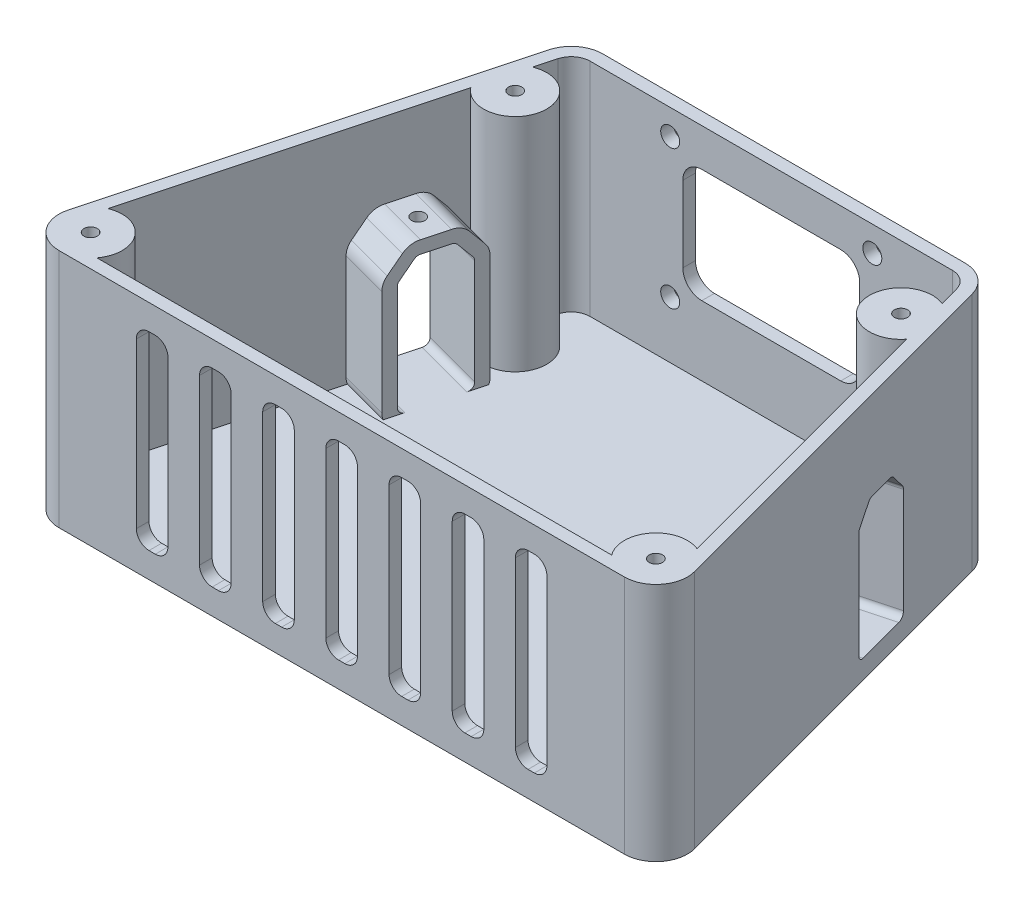
from build123d import *

# Parameters (mm, degrees)
BOSS_EXTRUDE1_DEPTH     = 38
FILLET1_R               = 5
CUT_EXTRUDE3_DEPTH      = 35
SKETCH6_R               = 5
BOSS_EXTRUDE2_DEPTH     = 35
SKETCH7_R               = 1.05
CUT_EXTRUDE5_DEPTH      = 8
CUT_EXTRUDE7_DEPTH      = 6
SKETCH12_W              = 28
SKETCH12_H              = 18
CUT_EXTRUDE8_DEPTH      = 3
FILLET7_R               = 3
FILLET6_R               = 1
FILLET8_R               = 3
SKETCH13_R              = 1.5
CUT_EXTRUDE9_DEPTH      = 10
BOSS_EXTRUDE3_START     = -10
BOSS_EXTRUDE3_DEPTH     = 10
SKETCH26_R              = 1.05
CUT_EXTRUDE17_DEPTH     = 15
CUT_EXTRUDE14_DEPTH     = 10
LPATTERN1_COUNT         = 4
LPATTERN1_PITCH         = 10
LPATTERN2_COPY_1_DEPTH  = 10
LPATTERN2_COPY_2_DEPTH  = 10
LPATTERN2_COPY_3_DEPTH  = 10
LPATTERN2_COPY_4_DEPTH  = 10
LPATTERN2_COPY_5_DEPTH  = 10
LPATTERN2_COPY_6_DEPTH  = 10
LPATTERN2_COPY_7_DEPTH  = 10
LPATTERN2_COPY_8_DEPTH  = 10
LPATTERN2_COPY_9_DEPTH  = 10
LPATTERN2_COPY_10_DEPTH = 10
LPATTERN2_COPY_11_DEPTH = 10
LPATTERN2_COPY_12_DEPTH = 10


# Read off the part's stored shape, not the designer's step: Mirror1
with BuildPart() as part:
    # Sketch1 → Boss-Extrude1 (new body)
    with BuildSketch(Plane(origin=(0, 0, 0), x_dir=(1, 0, 0), z_dir=(0, 1, 0))):
        Polygon((-51.25644347, 0), (51.25644347, 0), (32.5, 70), (-32.5, 70), align=None)
    extrude(amount=BOSS_EXTRUDE1_DEPTH)

    # Fillet1
    fillet1_edges = [part.edges().sort_by_distance(p)[0] for p in [
        (-32.5, 19, -70),
        (32.5, 19, -70),
        (51.25644347, 19, 0),
        (-51.25644347, 19, 0),
    ]]
    fillet(fillet1_edges, radius=FILLET1_R)

    # Sketch4 → Cut-Extrude3 (cut)
    with BuildSketch(Plane(origin=(0, 38, 0), x_dir=(1, 0, 0), z_dir=(0, 1, 0))):
        with BuildLine():
            Line((28.66336506, 68), (-28.66336506, 68))
            ThreePointArc((-28.66336506, 68), (-30.489649347, 67.380060021), (-31.561142539, 65.776457135))
            Line((-31.561142539, 65.776457135), (-47.638094085, 5.776457135))
            ThreePointArc((-47.638094085, 5.776457135), (-47.120376627, 3.173715713), (-44.740316606, 2))
            Line((-44.740316606, 2), (44.740316606, 2))
            ThreePointArc((44.740316606, 2), (47.120376627, 3.173715713), (47.638094085, 5.776457135))
            Line((47.638094085, 5.776457135), (31.561142539, 65.776457135))
            ThreePointArc((31.561142539, 65.776457135), (30.489649347, 67.380060021), (28.66336506, 68))
        make_face()
    extrude(amount=-CUT_EXTRUDE3_DEPTH, mode=Mode.SUBTRACT)

    # Sketch6 → Boss-Extrude2 (add)
    with BuildSketch(Plane(origin=(0, 38, 0), x_dir=(1, 0, 0), z_dir=(0, 1, 0))):
        with Locations((-30.539009407, 58)):
            Circle(SKETCH6_R)
        with Locations((-44.740316606, 5)):
            Circle(SKETCH6_R)
        with Locations((44.740316606, 5)):
            Circle(SKETCH6_R)
        with Locations((30.539009407, 58)):
            Circle(SKETCH6_R)
    extrude(amount=-BOSS_EXTRUDE2_DEPTH)

    # Sketch7 → Cut-Extrude5 (cut)
    with BuildSketch(Plane(origin=(0, 38, 0), x_dir=(1, 0, 0), z_dir=(0, 1, 0))):
        with Locations(Location((-30.539009407, 58, 0), (0, 0, 270))):
            Circle(SKETCH7_R)
        with Locations(Location((-44.740316606, 5, 0), (0, 0, 270))):
            Circle(SKETCH7_R)
        with Locations(Location((44.740316606, 5, 0), (0, 0, 270))):
            Circle(SKETCH7_R)
        with Locations(Location((30.539009407, 58, 0), (0, 0, 270))):
            Circle(SKETCH7_R)
    extrude(amount=-CUT_EXTRUDE5_DEPTH, mode=Mode.SUBTRACT)

    # Sketch10 → Cut-Extrude7 (cut)
    with BuildSketch(Plane(origin=(47.822912811, 0, -12.814110868), x_dir=(-0.258819045102518, 0, -0.9659258262890691), z_dir=(0.9659258262890691, 0, -0.258819045102518))):
        Polygon((30, 3), (40, 3), (40, 21), (37.5, 24), (32.5, 24), (30, 21), align=None)
    extrude(amount=-CUT_EXTRUDE7_DEPTH, mode=Mode.SUBTRACT)

    # Sketch12 → Cut-Extrude8 (cut)
    with BuildSketch(Plane(origin=(0, 0, -70), x_dir=(-1, 0, 0), z_dir=(0, 0, -1))):
        with Locations((0, 23)):
            Rectangle(SKETCH12_W, SKETCH12_H)
    extrude(amount=-CUT_EXTRUDE8_DEPTH, mode=Mode.SUBTRACT)

    # Fillet7
    fillet7_edges = [part.edges().sort_by_distance(p)[0] for p in [
        (14, 14, -69),
    ]]
    fillet(fillet7_edges, radius=FILLET7_R)

    # Fillet6
    fillet6_edges = [part.edges().sort_by_distance(p)[0] for p in [
        (39.092415632, 21, -41.533066611),
        (38.445368019, 24, -43.947881177),
        (37.151272794, 24, -48.777510308),
        (36.504225181, 3, -51.192324874),
        (39.092415632, 3, -41.533066611),
        (36.504225181, 21, -51.192324874),
    ]]
    fillet(fillet6_edges, radius=FILLET6_R)

    # Fillet8
    fillet8_edges = [part.edges().sort_by_distance(p)[0] for p in [
        (14, 32, -69),
        (-14, 32, -69),
        (-14, 14, -69),
    ]]
    fillet(fillet8_edges, radius=FILLET8_R)

    # Sketch13 → Cut-Extrude9 (cut)
    with BuildSketch(Plane(origin=(0, 0, -70), x_dir=(-1, 0, 0), z_dir=(0, 0, -1))):
        with Locations((16, 34)):
            Circle(SKETCH13_R)
        with Locations((-16, 34)):
            Circle(SKETCH13_R)
        with Locations((-16, 12)):
            Circle(SKETCH13_R)
        with Locations((16, 12)):
            Circle(SKETCH13_R)
    extrude(amount=-CUT_EXTRUDE9_DEPTH, mode=Mode.SUBTRACT)

    # Sketch25 → Boss-Extrude3 (add)
    with BuildSketch(Plane(origin=(47.822912811, 0, -12.814110868), x_dir=(-0.25881904510251796, 0, -0.9659258262890691), z_dir=(0.9659258262890691, 0, -0.25881904510251796)).offset(BOSS_EXTRUDE3_START)):
        with BuildLine():
            Line((31, 1), (39, 1))
            ThreePointArc((39, 1), (41.121320344, 1.878679656), (42, 4))
            Line((42, 4), (42, 20.637950065))
            ThreePointArc((42, 20.637950065), (41.820814733, 21.659225856), (41.304663839, 22.558503264))
            Line((41.304663839, 22.558503264), (39.336288893, 24.920553199))
            ThreePointArc((39.336288893, 24.920553199), (38.304091243, 25.716768264), (37.031625054, 26))
            Line((37.031625054, 26), (32.968374946, 26))
            ThreePointArc((32.968374946, 26), (31.695908757, 25.716768264), (30.663711107, 24.920553199))
            Line((30.663711107, 24.920553199), (28.695336161, 22.558503264))
            ThreePointArc((28.695336161, 22.558503264), (28.179185267, 21.659225856), (28, 20.637950065))
            Line((28, 20.637950065), (28, 4))
            ThreePointArc((28, 4), (28.878679656, 1.878679656), (31, 1))
        make_face()
        with BuildLine():
            Line((40, 4), (40, 20.637950065))
            ThreePointArc((40, 20.637950065), (39.940271578, 20.978375329), (39.76822128, 21.278134464))
            Line((39.76822128, 21.278134464), (37.799846334, 23.6401844))
            ThreePointArc((37.799846334, 23.6401844), (37.45578045, 23.905589421), (37.031625054, 24))
            Line((37.031625054, 24), (32.968374946, 24))
            ThreePointArc((32.968374946, 24), (32.54421955, 23.905589421), (32.200153666, 23.6401844))
            Line((32.200153666, 23.6401844), (30.23177872, 21.278134464))
            ThreePointArc((30.23177872, 21.278134464), (30.059728422, 20.978375329), (30, 20.637950065))
            Line((30, 20.637950065), (30, 4))
            ThreePointArc((30, 4), (30.292893219, 3.292893219), (31, 3))
            Line((31, 3), (39, 3))
            ThreePointArc((39, 3), (39.707106781, 3.292893219), (40, 4))
        make_face(mode=Mode.SUBTRACT)
    extrude(amount=BOSS_EXTRUDE3_DEPTH)

    # Sketch26 → Cut-Extrude17 (cut)
    with BuildSketch(Plane(origin=(0, 26, 0), x_dir=(1, 0, 0), z_dir=(0, 1, 0))):
        with Locations(Location((32.948421739, 45.063169311, 0), (0, 0, 270))):
            Circle(SKETCH26_R)
    extrude(amount=-CUT_EXTRUDE17_DEPTH, mode=Mode.SUBTRACT)

    # Mirror1
    split(bisect_by=Plane(origin=(0, 0, 0), x_dir=(0, 0, 1), z_dir=(1, 0, 0)), keep=Keep.TOP)

    # Mirror1 2: part across plane


with BuildPart() as part_1:
    add(part.part)
    add(part.part.mirror(Plane(origin=(0, 0, 0), x_dir=(0, 0, 1), z_dir=(1, 0, 0))))

    # Sketch22 → Cut-Extrude14 (cut)
    with BuildSketch(Plane.XY):
        with BuildLine():
            Line((-0.5, 4), (0.5, 4))
            ThreePointArc((0.5, 4), (1.914213562, 4.585786438), (2.5, 6))
            Line((2.5, 6), (2.5, 32))
            ThreePointArc((2.5, 32), (1.914213562, 33.414213562), (0.5, 34))
            Line((0.5, 34), (-0.5, 34))
            ThreePointArc((-0.5, 34), (-1.914213562, 33.414213562), (-2.5, 32))
            Line((-2.5, 32), (-2.5, 6))
            ThreePointArc((-2.5, 6), (-1.914213562, 4.585786438), (-0.5, 4))
        make_face()
    cut_extrude14 = extrude(amount=-CUT_EXTRUDE14_DEPTH, mode=Mode.SUBTRACT)

    # LPattern1: Cut-Extrude14 ×4
    with Locations(*[(i * LPATTERN1_PITCH, 0, 0) for i in range(1, LPATTERN1_COUNT)]):
        add(cut_extrude14, mode=Mode.SUBTRACT)

    # LPattern2 copy 1 sketch → LPattern2 copy 1 (cut)
    with BuildSketch(Plane.XY):
        with BuildLine():
            Line((-0.5, 4), (0.5, 4))
            ThreePointArc((0.5, 4), (1.914213562, 4.585786438), (2.5, 6))
            Line((2.5, 6), (2.5, 32))
            ThreePointArc((2.5, 32), (1.914213562, 33.414213562), (0.5, 34))
            Line((0.5, 34), (-0.5, 34))
            ThreePointArc((-0.5, 34), (-1.914213562, 33.414213562), (-2.5, 32))
            Line((-2.5, 32), (-2.5, 6))
            ThreePointArc((-2.5, 6), (-1.914213562, 4.585786438), (-0.5, 4))
        make_face()
    extrude(amount=-LPATTERN2_COPY_1_DEPTH, mode=Mode.SUBTRACT)

    # LPattern2 copy 2 sketch → LPattern2 copy 2 (cut)
    with BuildSketch(Plane(origin=(-10, 0, 0), x_dir=(1, 0, 0), z_dir=(0, 0, 1))):
        with BuildLine():
            Line((-0.5, 4), (0.5, 4))
            ThreePointArc((0.5, 4), (1.914213562, 4.585786438), (2.5, 6))
            Line((2.5, 6), (2.5, 32))
            ThreePointArc((2.5, 32), (1.914213562, 33.414213562), (0.5, 34))
            Line((0.5, 34), (-0.5, 34))
            ThreePointArc((-0.5, 34), (-1.914213562, 33.414213562), (-2.5, 32))
            Line((-2.5, 32), (-2.5, 6))
            ThreePointArc((-2.5, 6), (-1.914213562, 4.585786438), (-0.5, 4))
        make_face()
    extrude(amount=-LPATTERN2_COPY_2_DEPTH, mode=Mode.SUBTRACT)

    # LPattern2 copy 3 sketch → LPattern2 copy 3 (cut)
    with BuildSketch(Plane(origin=(-20, 0, 0), x_dir=(1, 0, 0), z_dir=(0, 0, 1))):
        with BuildLine():
            Line((-0.5, 4), (0.5, 4))
            ThreePointArc((0.5, 4), (1.914213562, 4.585786438), (2.5, 6))
            Line((2.5, 6), (2.5, 32))
            ThreePointArc((2.5, 32), (1.914213562, 33.414213562), (0.5, 34))
            Line((0.5, 34), (-0.5, 34))
            ThreePointArc((-0.5, 34), (-1.914213562, 33.414213562), (-2.5, 32))
            Line((-2.5, 32), (-2.5, 6))
            ThreePointArc((-2.5, 6), (-1.914213562, 4.585786438), (-0.5, 4))
        make_face()
    extrude(amount=-LPATTERN2_COPY_3_DEPTH, mode=Mode.SUBTRACT)

    # LPattern2 copy 4 sketch → LPattern2 copy 4 (cut)
    with BuildSketch(Plane(origin=(10, 0, 0), x_dir=(1, 0, 0), z_dir=(0, 0, 1))):
        with BuildLine():
            Line((-0.5, 4), (0.5, 4))
            ThreePointArc((0.5, 4), (1.914213562, 4.585786438), (2.5, 6))
            Line((2.5, 6), (2.5, 32))
            ThreePointArc((2.5, 32), (1.914213562, 33.414213562), (0.5, 34))
            Line((0.5, 34), (-0.5, 34))
            ThreePointArc((-0.5, 34), (-1.914213562, 33.414213562), (-2.5, 32))
            Line((-2.5, 32), (-2.5, 6))
            ThreePointArc((-2.5, 6), (-1.914213562, 4.585786438), (-0.5, 4))
        make_face()
    extrude(amount=-LPATTERN2_COPY_4_DEPTH, mode=Mode.SUBTRACT)

    # LPattern2 copy 5 sketch → LPattern2 copy 5 (cut)
    with BuildSketch(Plane.XY):
        with BuildLine():
            Line((-0.5, 4), (0.5, 4))
            ThreePointArc((0.5, 4), (1.914213562, 4.585786438), (2.5, 6))
            Line((2.5, 6), (2.5, 32))
            ThreePointArc((2.5, 32), (1.914213562, 33.414213562), (0.5, 34))
            Line((0.5, 34), (-0.5, 34))
            ThreePointArc((-0.5, 34), (-1.914213562, 33.414213562), (-2.5, 32))
            Line((-2.5, 32), (-2.5, 6))
            ThreePointArc((-2.5, 6), (-1.914213562, 4.585786438), (-0.5, 4))
        make_face()
    extrude(amount=-LPATTERN2_COPY_5_DEPTH, mode=Mode.SUBTRACT)

    # LPattern2 copy 6 sketch → LPattern2 copy 6 (cut)
    with BuildSketch(Plane(origin=(-10, 0, 0), x_dir=(1, 0, 0), z_dir=(0, 0, 1))):
        with BuildLine():
            Line((-0.5, 4), (0.5, 4))
            ThreePointArc((0.5, 4), (1.914213562, 4.585786438), (2.5, 6))
            Line((2.5, 6), (2.5, 32))
            ThreePointArc((2.5, 32), (1.914213562, 33.414213562), (0.5, 34))
            Line((0.5, 34), (-0.5, 34))
            ThreePointArc((-0.5, 34), (-1.914213562, 33.414213562), (-2.5, 32))
            Line((-2.5, 32), (-2.5, 6))
            ThreePointArc((-2.5, 6), (-1.914213562, 4.585786438), (-0.5, 4))
        make_face()
    extrude(amount=-LPATTERN2_COPY_6_DEPTH, mode=Mode.SUBTRACT)

    # LPattern2 copy 7 sketch → LPattern2 copy 7 (cut)
    with BuildSketch(Plane(origin=(20, 0, 0), x_dir=(1, 0, 0), z_dir=(0, 0, 1))):
        with BuildLine():
            Line((-0.5, 4), (0.5, 4))
            ThreePointArc((0.5, 4), (1.914213562, 4.585786438), (2.5, 6))
            Line((2.5, 6), (2.5, 32))
            ThreePointArc((2.5, 32), (1.914213562, 33.414213562), (0.5, 34))
            Line((0.5, 34), (-0.5, 34))
            ThreePointArc((-0.5, 34), (-1.914213562, 33.414213562), (-2.5, 32))
            Line((-2.5, 32), (-2.5, 6))
            ThreePointArc((-2.5, 6), (-1.914213562, 4.585786438), (-0.5, 4))
        make_face()
    extrude(amount=-LPATTERN2_COPY_7_DEPTH, mode=Mode.SUBTRACT)

    # LPattern2 copy 8 sketch → LPattern2 copy 8 (cut)
    with BuildSketch(Plane(origin=(10, 0, 0), x_dir=(1, 0, 0), z_dir=(0, 0, 1))):
        with BuildLine():
            Line((-0.5, 4), (0.5, 4))
            ThreePointArc((0.5, 4), (1.914213562, 4.585786438), (2.5, 6))
            Line((2.5, 6), (2.5, 32))
            ThreePointArc((2.5, 32), (1.914213562, 33.414213562), (0.5, 34))
            Line((0.5, 34), (-0.5, 34))
            ThreePointArc((-0.5, 34), (-1.914213562, 33.414213562), (-2.5, 32))
            Line((-2.5, 32), (-2.5, 6))
            ThreePointArc((-2.5, 6), (-1.914213562, 4.585786438), (-0.5, 4))
        make_face()
    extrude(amount=-LPATTERN2_COPY_8_DEPTH, mode=Mode.SUBTRACT)

    # LPattern2 copy 9 sketch → LPattern2 copy 9 (cut)
    with BuildSketch(Plane.XY):
        with BuildLine():
            Line((-0.5, 4), (0.5, 4))
            ThreePointArc((0.5, 4), (1.914213562, 4.585786438), (2.5, 6))
            Line((2.5, 6), (2.5, 32))
            ThreePointArc((2.5, 32), (1.914213562, 33.414213562), (0.5, 34))
            Line((0.5, 34), (-0.5, 34))
            ThreePointArc((-0.5, 34), (-1.914213562, 33.414213562), (-2.5, 32))
            Line((-2.5, 32), (-2.5, 6))
            ThreePointArc((-2.5, 6), (-1.914213562, 4.585786438), (-0.5, 4))
        make_face()
    extrude(amount=-LPATTERN2_COPY_9_DEPTH, mode=Mode.SUBTRACT)

    # LPattern2 copy 10 sketch → LPattern2 copy 10 (cut)
    with BuildSketch(Plane(origin=(-10, 0, 0), x_dir=(1, 0, 0), z_dir=(0, 0, 1))):
        with BuildLine():
            Line((-0.5, 4), (0.5, 4))
            ThreePointArc((0.5, 4), (1.914213562, 4.585786438), (2.5, 6))
            Line((2.5, 6), (2.5, 32))
            ThreePointArc((2.5, 32), (1.914213562, 33.414213562), (0.5, 34))
            Line((0.5, 34), (-0.5, 34))
            ThreePointArc((-0.5, 34), (-1.914213562, 33.414213562), (-2.5, 32))
            Line((-2.5, 32), (-2.5, 6))
            ThreePointArc((-2.5, 6), (-1.914213562, 4.585786438), (-0.5, 4))
        make_face()
    extrude(amount=-LPATTERN2_COPY_10_DEPTH, mode=Mode.SUBTRACT)

    # LPattern2 copy 11 sketch → LPattern2 copy 11 (cut)
    with BuildSketch(Plane(origin=(-20, 0, 0), x_dir=(1, 0, 0), z_dir=(0, 0, 1))):
        with BuildLine():
            Line((-0.5, 4), (0.5, 4))
            ThreePointArc((0.5, 4), (1.914213562, 4.585786438), (2.5, 6))
            Line((2.5, 6), (2.5, 32))
            ThreePointArc((2.5, 32), (1.914213562, 33.414213562), (0.5, 34))
            Line((0.5, 34), (-0.5, 34))
            ThreePointArc((-0.5, 34), (-1.914213562, 33.414213562), (-2.5, 32))
            Line((-2.5, 32), (-2.5, 6))
            ThreePointArc((-2.5, 6), (-1.914213562, 4.585786438), (-0.5, 4))
        make_face()
    extrude(amount=-LPATTERN2_COPY_11_DEPTH, mode=Mode.SUBTRACT)

    # LPattern2 copy 12 sketch → LPattern2 copy 12 (cut)
    with BuildSketch(Plane(origin=(-30, 0, 0), x_dir=(1, 0, 0), z_dir=(0, 0, 1))):
        with BuildLine():
            Line((-0.5, 4), (0.5, 4))
            ThreePointArc((0.5, 4), (1.914213562, 4.585786438), (2.5, 6))
            Line((2.5, 6), (2.5, 32))
            ThreePointArc((2.5, 32), (1.914213562, 33.414213562), (0.5, 34))
            Line((0.5, 34), (-0.5, 34))
            ThreePointArc((-0.5, 34), (-1.914213562, 33.414213562), (-2.5, 32))
            Line((-2.5, 32), (-2.5, 6))
            ThreePointArc((-2.5, 6), (-1.914213562, 4.585786438), (-0.5, 4))
        make_face()
    extrude(amount=-LPATTERN2_COPY_12_DEPTH, mode=Mode.SUBTRACT)


solid = part_1.part
